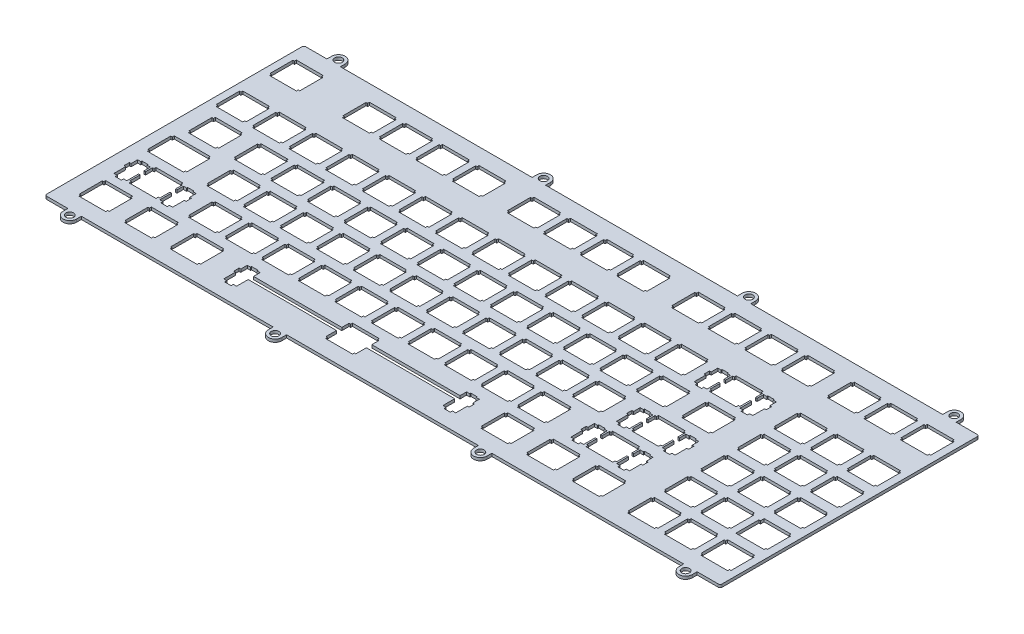
from build123d import *

# Parameters (mm, degrees)
SKETCH1_R           = 2
BOSS_EXTRUDE1_DEPTH = 1.5
FILLET1_R           = 1


with BuildPart() as part:
    # Sketch1 → Boss-Extrude1 (new body)
    with BuildSketch(Plane(origin=(0, 0, 0), x_dir=(1, 0, 0), z_dir=(0, 1, 0))):
        with BuildLine():
            Line((7.499068395, 437.918742248), (7.46317002, 435.419))
            Line((7.46317002, 435.419), (107.46317002, 435.419))
            Line((107.46317002, 435.419), (107.46317002, 437.919))
            ThreePointArc((107.46317002, 437.919), (110.96317002, 441.419), (114.46317002, 437.919))
            Line((114.46317002, 437.919), (114.46317002, 435.419))
            Line((114.46317002, 435.419), (214.46317002, 435.419))
            Line((214.46317002, 435.419), (214.46317002, 437.919))
            ThreePointArc((214.46317002, 437.919), (217.96317002, 441.419), (221.46317002, 437.919))
            Line((221.46317002, 437.919), (221.46317002, 435.419))
            Line((221.46317002, 435.419), (321.46317002, 435.419))
            Line((321.46317002, 435.419), (321.46317002, 437.919))
            ThreePointArc((321.46317002, 437.919), (324.96317002, 441.419), (328.46317002, 437.919))
            Line((328.46317002, 437.919), (328.46317002, 435.419))
            Line((328.46317002, 435.419), (340.46317002, 435.419))
            Line((340.46317002, 435.419), (340.46317002, 300.419))
            Line((340.46317002, 300.419), (328.46317002, 300.419))
            Line((328.46317002, 300.419), (328.46317002, 297.919))
            ThreePointArc((328.46317002, 297.919), (324.96317002, 294.419), (321.46317002, 297.919))
            Line((321.46317002, 297.919), (321.46317002, 300.419))
            Line((321.46317002, 300.419), (221.46317002, 300.419))
            Line((221.46317002, 300.419), (221.46317002, 297.919))
            ThreePointArc((221.46317002, 297.919), (217.96317002, 294.419), (214.46317002, 297.919))
            Line((214.46317002, 297.919), (214.46317002, 300.419))
            Line((214.46317002, 300.419), (114.46317002, 300.419))
            Line((114.46317002, 300.419), (114.46317002, 297.919))
            ThreePointArc((114.46317002, 297.919), (110.96317002, 294.419), (107.46317002, 297.919))
            Line((107.46317002, 297.919), (107.46317002, 300.419))
            Line((107.46317002, 300.419), (7.46317002, 300.419))
            Line((7.46317002, 300.419), (7.46317002, 297.919))
            ThreePointArc((7.46317002, 297.919), (3.96317002, 294.419), (0.46317002, 297.919))
            Line((0.46317002, 297.919), (0.46317002, 300.419))
            Line((0.46317002, 300.419), (-11.53682998, 300.419))
            Line((-11.53682998, 300.419), (-11.53682998, 435.419))
            Line((-11.53682998, 435.419), (0.46317002, 435.419))
            Line((0.46317002, 435.419), (0.499068405, 437.919))
            ThreePointArc((0.499068405, 437.919), (3.999197281, 441.418999998), (7.499068395, 437.918742248))
        make_face()
        with Locations((3.999068405, 437.919)):
            Circle(SKETCH1_R, mode=Mode.SUBTRACT)
        with Locations((110.96317002, 437.919)):
            Circle(SKETCH1_R, mode=Mode.SUBTRACT)
        with Locations((217.96317002, 437.919)):
            Circle(SKETCH1_R, mode=Mode.SUBTRACT)
        with Locations((3.96317002, 297.919)):
            Circle(SKETCH1_R, mode=Mode.SUBTRACT)
        with Locations((110.96317002, 297.919)):
            Circle(SKETCH1_R, mode=Mode.SUBTRACT)
        with Locations((324.96317002, 297.919)):
            Circle(SKETCH1_R, mode=Mode.SUBTRACT)
        with Locations((217.96317002, 297.919)):
            Circle(SKETCH1_R, mode=Mode.SUBTRACT)
        with Locations((324.96317002, 437.919)):
            Circle(SKETCH1_R, mode=Mode.SUBTRACT)
        Polygon((-7.7978, 425.99356), (-7.7978, 413.98444), (-6.985, 413.98444), (-6.985, 413.004), (6.985, 413.004), (6.985, 413.98444), (7.7978, 413.98444), (7.7978, 425.99356), (6.985, 425.99356), (6.985, 426.974), (-6.985, 426.974), (-6.985, 425.99356), align=None, mode=Mode.SUBTRACT)
        Polygon((30.3022, 413.98444), (30.3022, 425.99356), (31.115, 425.99356), (31.115, 426.974), (45.085, 426.974), (45.085, 425.99356), (45.8978, 425.99356), (45.8978, 413.98444), (45.085, 413.98444), (45.085, 413.004), (31.115, 413.004), (31.115, 413.98444), align=None, mode=Mode.SUBTRACT)
        Polygon((243.04752, 341.884), (257.01752, 341.884), (257.01752, 340.90356), (257.83032, 340.90356), (257.83032, 337.185), (258.64312, 337.185), (258.64312, 340.5886), (260.31952, 340.5886), (260.31952, 341.122), (263.62152, 341.122), (263.62152, 340.5886), (265.29792, 340.5886), (265.29792, 337.185), (266.18692, 337.185), (266.18692, 334.391), (265.29792, 334.391), (265.29792, 328.295), (263.62152, 328.295), (263.62152, 327.152), (260.31952, 327.152), (260.31952, 328.295), (258.64312, 328.295), (258.64312, 334.391), (257.83032, 334.391), (257.83032, 329.0824), (257.01752, 329.0824), (257.01752, 327.914), (243.04752, 327.914), (243.04752, 329.0824), (242.23472, 329.0824), (242.23472, 334.391), (241.42192, 334.391), (241.42192, 328.295), (239.74552, 328.295), (239.74552, 327.152), (236.44352, 327.152), (236.44352, 328.295), (234.76712, 328.295), (234.76712, 334.391), (233.87812, 334.391), (233.87812, 337.185), (234.76712, 337.185), (234.76712, 340.5886), (236.44352, 340.5886), (236.44352, 341.122), (239.74552, 341.122), (239.74552, 340.5886), (241.42192, 340.5886), (241.42192, 337.185), (242.23472, 337.185), (242.23472, 340.90356), (243.04752, 340.90356), align=None, mode=Mode.SUBTRACT)
        Polygon((250.19, 399.034), (264.16, 399.034), (264.16, 398.05356), (264.9728, 398.05356), (264.9728, 394.335), (265.7856, 394.335), (265.7856, 397.7386), (267.462, 397.7386), (267.462, 398.272), (270.764, 398.272), (270.764, 397.7386), (272.4404, 397.7386), (272.4404, 394.335), (273.3294, 394.335), (273.3294, 391.541), (272.4404, 391.541), (272.4404, 385.445), (270.764, 385.445), (270.764, 384.302), (267.462, 384.302), (267.462, 385.445), (265.7856, 385.445), (265.7856, 391.541), (264.9728, 391.541), (264.9728, 386.2324), (264.16, 386.2324), (264.16, 385.064), (250.19, 385.064), (250.19, 386.2324), (249.3772, 386.2324), (249.3772, 391.541), (248.5644, 391.541), (248.5644, 385.445), (246.888, 385.445), (246.888, 384.302), (243.586, 384.302), (243.586, 385.445), (241.9096, 385.445), (241.9096, 391.541), (241.0206, 391.541), (241.0206, 394.335), (241.9096, 394.335), (241.9096, 397.7386), (243.586, 397.7386), (243.586, 398.272), (246.888, 398.272), (246.888, 397.7386), (248.5644, 397.7386), (248.5644, 394.335), (249.3772, 394.335), (249.3772, 398.05356), (250.19, 398.05356), align=None, mode=Mode.SUBTRACT)
        Polygon((247.81002, 360.934), (261.78002, 360.934), (261.78002, 359.95356), (262.59282, 359.95356), (262.59282, 356.235), (263.40562, 356.235), (263.40562, 359.6386), (265.08202, 359.6386), (265.08202, 360.172), (268.38402, 360.172), (268.38402, 359.6386), (270.06042, 359.6386), (270.06042, 356.235), (270.94942, 356.235), (270.94942, 353.441), (270.06042, 353.441), (270.06042, 347.345), (268.38402, 347.345), (268.38402, 346.202), (265.08202, 346.202), (265.08202, 347.345), (263.40562, 347.345), (263.40562, 353.441), (262.59282, 353.441), (262.59282, 348.1324), (261.78002, 348.1324), (261.78002, 346.964), (247.81002, 346.964), (247.81002, 348.1324), (246.99722, 348.1324), (246.99722, 353.441), (246.18442, 353.441), (246.18442, 347.345), (244.50802, 347.345), (244.50802, 346.202), (241.20602, 346.202), (241.20602, 347.345), (239.52962, 347.345), (239.52962, 353.441), (238.64062, 353.441), (238.64062, 356.235), (239.52962, 356.235), (239.52962, 359.6386), (241.20602, 359.6386), (241.20602, 360.172), (244.50802, 360.172), (244.50802, 359.6386), (246.18442, 359.6386), (246.18442, 356.235), (246.99722, 356.235), (246.99722, 359.95356), (247.81002, 359.95356), align=None, mode=Mode.SUBTRACT)
        Polygon((4.92252, 341.884), (18.89252, 341.884), (18.89252, 340.90356), (19.70532, 340.90356), (19.70532, 337.185), (20.51812, 337.185), (20.51812, 340.5886), (22.19452, 340.5886), (22.19452, 341.122), (25.49652, 341.122), (25.49652, 340.5886), (27.17292, 340.5886), (27.17292, 337.185), (28.061919999, 337.185), (28.061919999, 334.391), (27.172919999, 334.391), (27.172919999, 328.295), (25.496519999, 328.295), (25.496519999, 327.152), (22.194519999, 327.152), (22.194519999, 328.295), (20.518119999, 328.295), (20.518119999, 334.391), (19.70532, 334.391), (19.70532, 329.0824), (18.89252, 329.0824), (18.89252, 327.914), (4.92252, 327.914), (4.92252, 329.0824), (4.10972, 329.0824), (4.10972, 334.391), (3.29692, 334.391), (3.29692, 328.295), (1.62052, 328.295), (1.62052, 327.152), (-1.68148, 327.152), (-1.68148, 328.295), (-3.35788, 328.295), (-3.35788, 334.391), (-4.24688, 334.391), (-4.24688, 337.185), (-3.35788, 337.185), (-3.35788, 340.5886), (-1.68148, 340.5886), (-1.68148, 341.122), (1.62052, 341.122), (1.62052, 340.5886), (3.29692, 340.5886), (3.29692, 337.185), (4.10972, 337.185), (4.10972, 340.90356), (4.92252, 340.90356), align=None, mode=Mode.SUBTRACT)
        Polygon((126.3652, 322.834), (140.3352, 322.834), (140.3352, 321.85356), (141.148, 321.85356), (141.148, 318.135), (187.1728, 318.135), (187.1728, 321.5386), (188.8492, 321.5386), (188.8492, 322.072), (192.1512, 322.072), (192.1512, 321.5386), (193.8276, 321.5386), (193.8276, 318.135), (194.7166, 318.135), (194.7166, 315.341), (193.8276, 315.341), (193.8276, 309.245), (192.1512, 309.245), (192.1512, 308.102), (188.8492, 308.102), (188.8492, 309.245), (187.1728, 309.245), (187.1728, 315.341), (141.148, 315.341), (141.148, 309.84444), (140.3352, 309.84444), (140.3352, 308.864), (126.3652, 308.864), (126.3652, 309.84444), (125.5524, 309.84444), (125.5524, 315.341), (79.5276, 315.341), (79.5276, 309.245), (77.8512, 309.245), (77.8512, 308.102), (74.5492, 308.102), (74.5492, 309.245), (72.8728, 309.245), (72.8728, 315.341), (71.9838, 315.341), (71.9838, 318.135), (72.8728, 318.135), (72.8728, 321.5386), (74.5492, 321.5386), (74.5492, 322.072), (77.8512, 322.072), (77.8512, 321.5386), (79.5276, 321.5386), (79.5276, 318.135), (125.5524, 318.135), (125.5524, 321.85356), (126.3652, 321.85356), align=None, mode=Mode.SUBTRACT)
        Polygon((-4.602, 360.934), (14.131, 360.934), (14.131, 359.95356), (14.9438, 359.95356), (14.9438, 347.94444), (14.131, 347.94444), (14.131, 346.964), (-4.602, 346.964), (-4.602, 347.94444), (-5.4148, 347.94444), (-5.4148, 359.95356), (-4.602, 359.95356), align=None, mode=Mode.SUBTRACT)
        Polygon((336.727800003, 359.95356), (336.727800003, 347.94444), (335.915000003, 347.94444), (335.915000003, 346.964), (321.945000003, 346.964), (321.945000003, 347.94444), (321.132200003, 347.94444), (321.132200003, 359.95356), (321.945000003, 359.95356), (321.945000003, 360.934), (335.915000003, 360.934), (335.915000003, 359.95356), align=None, mode=Mode.SUBTRACT)
        Polygon((317.677800003, 359.95356), (317.677800003, 347.94444), (316.865000003, 347.94444), (316.865000003, 346.964), (302.895000003, 346.964), (302.895000003, 347.94444), (302.082200003, 347.94444), (302.082200003, 359.95356), (302.895000003, 359.95356), (302.895000003, 360.934), (316.865000003, 360.934), (316.865000003, 359.95356), align=None, mode=Mode.SUBTRACT)
        Polygon((298.627800003, 359.95356), (298.627800003, 347.94444), (297.815000003, 347.94444), (297.815000003, 346.964), (283.845000003, 346.964), (283.845000003, 347.94444), (283.032200003, 347.94444), (283.032200003, 359.95356), (283.845000003, 359.95356), (283.845000003, 360.934), (297.815000003, 360.934), (297.815000003, 359.95356), align=None, mode=Mode.SUBTRACT)
        Polygon((49.3522, 425.99356), (49.3522, 413.98444), (50.165, 413.98444), (50.165, 413.004), (64.135, 413.004), (64.135, 413.98444), (64.9478, 413.98444), (64.9478, 425.99356), (64.135, 425.99356), (64.135, 426.974), (50.165, 426.974), (50.165, 425.99356), align=None, mode=Mode.SUBTRACT)
        Polygon((68.4022, 413.98444), (68.4022, 425.99356), (69.215, 425.99356), (69.215, 426.974), (83.185, 426.974), (83.185, 425.99356), (83.9978, 425.99356), (83.9978, 413.98444), (83.185, 413.98444), (83.185, 413.004), (69.215, 413.004), (69.215, 413.98444), align=None, mode=Mode.SUBTRACT)
        Polygon((87.4522, 413.98444), (87.4522, 425.99356), (88.265, 425.99356), (88.265, 426.974), (102.235, 426.974), (102.235, 425.99356), (103.0478, 425.99356), (103.0478, 413.98444), (102.235, 413.98444), (102.235, 413.004), (88.265, 413.004), (88.265, 413.98444), align=None, mode=Mode.SUBTRACT)
        Polygon((116.0272, 413.984025998), (116.0272, 425.993145998), (116.84, 425.993145998), (116.84, 426.973585998), (130.81, 426.973585998), (130.81, 425.993145998), (131.6228, 425.993145998), (131.6228, 413.984025998), (130.81, 413.984025998), (130.81, 413.003585998), (116.84, 413.003585998), (116.84, 413.984025998), align=None, mode=Mode.SUBTRACT)
        Polygon((135.0772, 413.98444), (135.0772, 425.99356), (135.89, 425.99356), (135.89, 426.974), (149.86, 426.974), (149.86, 425.99356), (150.6728, 425.99356), (150.6728, 413.98444), (149.86, 413.98444), (149.86, 413.004), (135.89, 413.004), (135.89, 413.98444), align=None, mode=Mode.SUBTRACT)
        Polygon((154.1272, 413.98444), (154.1272, 425.99356), (154.94, 425.99356), (154.94, 426.974), (168.91, 426.974), (168.91, 425.99356), (169.7228, 425.99356), (169.7228, 413.98444), (168.91, 413.98444), (168.91, 413.004), (154.94, 413.004), (154.94, 413.98444), align=None, mode=Mode.SUBTRACT)
        Polygon((254.9524, 322.834), (268.9224, 322.834), (268.9224, 321.85356), (269.7352, 321.85356), (269.7352, 309.84444), (268.9224, 309.84444), (268.9224, 308.864), (254.9524, 308.864), (254.9524, 309.84444), (254.1396, 309.84444), (254.1396, 321.85356), (254.9524, 321.85356), align=None, mode=Mode.SUBTRACT)
        Polygon((173.1728, 425.99356), (173.1728, 413.98444), (173.9856, 413.98444), (173.9856, 413.004), (187.9556, 413.004), (187.9556, 413.98444), (188.7684, 413.98444), (188.7684, 425.99356), (187.9556, 425.99356), (187.9556, 426.974), (173.9856, 426.974), (173.9856, 425.99356), align=None, mode=Mode.SUBTRACT)
        Polygon((201.7522, 425.99356), (201.7522, 413.98444), (202.565, 413.98444), (202.565, 413.004), (216.535, 413.004), (216.535, 413.98444), (217.3478, 413.98444), (217.3478, 425.99356), (216.535, 425.99356), (216.535, 426.974), (202.565, 426.974), (202.565, 425.99356), align=None, mode=Mode.SUBTRACT)
        Polygon((258.9022, 425.99356), (258.9022, 413.98444), (259.715, 413.98444), (259.715, 413.004), (273.685, 413.004), (273.685, 413.98444), (274.4978, 413.98444), (274.4978, 425.99356), (273.685, 425.99356), (273.685, 426.974), (259.715, 426.974), (259.715, 425.99356), align=None, mode=Mode.SUBTRACT)
        Polygon((255.4478, 413.98444), (255.4478, 425.99356), (254.635, 425.99356), (254.635, 426.974), (240.665, 426.974), (240.665, 425.99356), (239.8522, 425.99356), (239.8522, 413.98444), (240.665, 413.98444), (240.665, 413.004), (254.635, 413.004), (254.635, 413.98444), align=None, mode=Mode.SUBTRACT)
        Polygon((236.3978, 413.98444), (236.3978, 425.99356), (235.585, 425.99356), (235.585, 426.974), (221.615, 426.974), (221.615, 425.99356), (220.8022, 425.99356), (220.8022, 413.98444), (221.615, 413.98444), (221.615, 413.004), (235.585, 413.004), (235.585, 413.98444), align=None, mode=Mode.SUBTRACT)
        Polygon((231.1398, 322.834), (245.1098, 322.834), (245.1098, 321.85356), (245.9226, 321.85356), (245.9226, 309.84444), (245.1098, 309.84444), (245.1098, 308.864), (231.1398, 308.864), (231.1398, 309.84444), (230.327, 309.84444), (230.327, 321.85356), (231.1398, 321.85356), align=None, mode=Mode.SUBTRACT)
        Polygon((283.0322, 425.99356), (283.0322, 413.98444), (283.845, 413.98444), (283.845, 413.004), (297.815, 413.004), (297.815, 413.98444), (298.6278, 413.98444), (298.6278, 425.99356), (297.815, 425.99356), (297.815, 426.974), (283.845, 426.974), (283.845, 425.99356), align=None, mode=Mode.SUBTRACT)
        Polygon((302.0822, 425.99356), (302.0822, 413.98444), (302.895, 413.98444), (302.895, 413.004), (316.865, 413.004), (316.865, 413.98444), (317.6778, 413.98444), (317.6778, 425.99356), (316.865, 425.99356), (316.865, 426.974), (302.895, 426.974), (302.895, 425.99356), align=None, mode=Mode.SUBTRACT)
        Polygon((321.1322, 425.99356), (321.1322, 413.98444), (321.945, 413.98444), (321.945, 413.004), (335.915, 413.004), (335.915, 413.98444), (336.7278, 413.98444), (336.7278, 425.99356), (335.915, 425.99356), (335.915, 426.974), (321.945, 426.974), (321.945, 425.99356), align=None, mode=Mode.SUBTRACT)
        Polygon((-7.7978, 398.05356), (-7.7978, 386.04444), (-6.985, 386.04444), (-6.985, 385.064), (6.985, 385.064), (6.985, 386.04444), (7.7978, 386.04444), (7.7978, 398.05356), (6.985, 398.05356), (6.985, 399.034), (-6.985, 399.034), (-6.985, 398.05356), align=None, mode=Mode.SUBTRACT)
        Polygon((11.2522, 398.05356), (11.2522, 386.04444), (12.065, 386.04444), (12.065, 385.064), (26.035, 385.064), (26.035, 386.04444), (26.8478, 386.04444), (26.8478, 398.05356), (26.035, 398.05356), (26.035, 399.034), (12.065, 399.034), (12.065, 398.05356), align=None, mode=Mode.SUBTRACT)
        Polygon((207.3272, 322.834), (221.2972, 322.834), (221.2972, 321.85356), (222.11, 321.85356), (222.11, 309.84444), (221.2972, 309.84444), (221.2972, 308.864), (207.3272, 308.864), (207.3272, 309.84444), (206.5144, 309.84444), (206.5144, 321.85356), (207.3272, 321.85356), align=None, mode=Mode.SUBTRACT)
        Polygon((30.3022, 398.05356), (30.3022, 386.04444), (31.115, 386.04444), (31.115, 385.064), (45.085, 385.064), (45.085, 386.04444), (45.8978, 386.04444), (45.8978, 398.05356), (45.085, 398.05356), (45.085, 399.034), (31.115, 399.034), (31.115, 398.05356), align=None, mode=Mode.SUBTRACT)
        Polygon((49.3522, 398.05356), (49.3522, 386.04444), (50.165, 386.04444), (50.165, 385.064), (64.135, 385.064), (64.135, 386.04444), (64.9478, 386.04444), (64.9478, 398.05356), (64.135, 398.05356), (64.135, 399.034), (50.165, 399.034), (50.165, 398.05356), align=None, mode=Mode.SUBTRACT)
        Polygon((68.4022, 398.05356), (68.4022, 386.04444), (69.215, 386.04444), (69.215, 385.064), (83.185, 385.064), (83.185, 386.04444), (83.9978, 386.04444), (83.9978, 398.05356), (83.185, 398.05356), (83.185, 399.034), (69.215, 399.034), (69.215, 398.05356), align=None, mode=Mode.SUBTRACT)
        Polygon((87.4522, 398.05356), (87.4522, 386.04444), (88.265, 386.04444), (88.265, 385.064), (102.235, 385.064), (102.235, 386.04444), (103.0478, 386.04444), (103.0478, 398.05356), (102.235, 398.05356), (102.235, 399.034), (88.265, 399.034), (88.265, 398.05356), align=None, mode=Mode.SUBTRACT)
        Polygon((106.5022, 398.05356), (106.5022, 386.04444), (107.315, 386.04444), (107.315, 385.064), (121.285, 385.064), (121.285, 386.04444), (122.0978, 386.04444), (122.0978, 398.05356), (121.285, 398.05356), (121.285, 399.034), (107.315, 399.034), (107.315, 398.05356), align=None, mode=Mode.SUBTRACT)
        Polygon((45.4032, 322.834), (59.3732, 322.834), (59.3732, 321.85356), (60.186, 321.85356), (60.186, 309.84444), (59.3732, 309.84444), (59.3732, 308.864), (45.4032, 308.864), (45.4032, 309.84444), (44.5904, 309.84444), (44.5904, 321.85356), (45.4032, 321.85356), align=None, mode=Mode.SUBTRACT)
        Polygon((125.5522, 398.05356), (125.5522, 386.04444), (126.365, 386.04444), (126.365, 385.064), (140.335, 385.064), (140.335, 386.04444), (141.1478, 386.04444), (141.1478, 398.05356), (140.335, 398.05356), (140.335, 399.034), (126.365, 399.034), (126.365, 398.05356), align=None, mode=Mode.SUBTRACT)
        Polygon((144.6022, 398.05356), (144.6022, 386.04444), (145.415, 386.04444), (145.415, 385.064), (159.385, 385.064), (159.385, 386.04444), (160.1978, 386.04444), (160.1978, 398.05356), (159.385, 398.05356), (159.385, 399.034), (145.415, 399.034), (145.415, 398.05356), align=None, mode=Mode.SUBTRACT)
        Polygon((163.6522, 398.05356), (163.6522, 386.04444), (164.465, 386.04444), (164.465, 385.064), (178.435, 385.064), (178.435, 386.04444), (179.2478, 386.04444), (179.2478, 398.05356), (178.435, 398.05356), (178.435, 399.034), (164.465, 399.034), (164.465, 398.05356), align=None, mode=Mode.SUBTRACT)
        Polygon((182.7022, 398.05356), (182.7022, 386.04444), (183.515, 386.04444), (183.515, 385.064), (197.485, 385.064), (197.485, 386.04444), (198.2978, 386.04444), (198.2978, 398.05356), (197.485, 398.05356), (197.485, 399.034), (183.515, 399.034), (183.515, 398.05356), align=None, mode=Mode.SUBTRACT)
        Polygon((201.7522, 398.05356), (201.7522, 386.04444), (202.565, 386.04444), (202.565, 385.064), (216.535, 385.064), (216.535, 386.04444), (217.3478, 386.04444), (217.3478, 398.05356), (216.535, 398.05356), (216.535, 399.034), (202.565, 399.034), (202.565, 398.05356), align=None, mode=Mode.SUBTRACT)
        Polygon((21.5906, 322.834), (35.5606, 322.834), (35.5606, 321.85356), (36.3734, 321.85356), (36.3734, 309.84444), (35.5606, 309.84444), (35.5606, 308.864), (21.5906, 308.864), (21.5906, 309.84444), (20.7778, 309.84444), (20.7778, 321.85356), (21.5906, 321.85356), align=None, mode=Mode.SUBTRACT)
        Polygon((220.8022, 398.05356), (220.8022, 386.04444), (221.615, 386.04444), (221.615, 385.064), (235.585, 385.064), (235.585, 386.04444), (236.3978, 386.04444), (236.3978, 398.05356), (235.585, 398.05356), (235.585, 399.034), (221.615, 399.034), (221.615, 398.05356), align=None, mode=Mode.SUBTRACT)
        Polygon((283.0322, 398.05356), (283.0322, 386.04444), (283.845, 386.04444), (283.845, 385.064), (297.815, 385.064), (297.815, 386.04444), (298.6278, 386.04444), (298.6278, 398.05356), (297.815, 398.05356), (297.815, 399.034), (283.845, 399.034), (283.845, 398.05356), align=None, mode=Mode.SUBTRACT)
        Polygon((302.0822, 398.05356), (302.0822, 386.04444), (302.895, 386.04444), (302.895, 385.064), (316.865, 385.064), (316.865, 386.04444), (317.6778, 386.04444), (317.6778, 398.05356), (316.865, 398.05356), (316.865, 399.034), (302.895, 399.034), (302.895, 398.05356), align=None, mode=Mode.SUBTRACT)
        Polygon((321.1322, 398.05356), (321.1322, 386.04444), (321.945, 386.04444), (321.945, 385.064), (335.915, 385.064), (335.915, 386.04444), (336.7278, 386.04444), (336.7278, 398.05356), (335.915, 398.05356), (335.915, 399.034), (321.945, 399.034), (321.945, 398.05356), align=None, mode=Mode.SUBTRACT)
        Polygon((336.7278, 379.00356), (336.7278, 366.99444), (335.915, 366.99444), (335.915, 366.014), (321.945, 366.014), (321.945, 366.99444), (321.1322, 366.99444), (321.1322, 379.00356), (321.945, 379.00356), (321.945, 379.984), (335.915, 379.984), (335.915, 379.00356), align=None, mode=Mode.SUBTRACT)
        Polygon((-2.222, 322.834), (11.748, 322.834), (11.748, 321.85356), (12.5608, 321.85356), (12.5608, 309.84444), (11.748, 309.84444), (11.748, 308.864), (-2.222, 308.864), (-2.222, 309.84444), (-3.0348, 309.84444), (-3.0348, 321.85356), (-2.222, 321.85356), align=None, mode=Mode.SUBTRACT)
        Polygon((317.6778, 379.00356), (317.6778, 366.99444), (316.865, 366.99444), (316.865, 366.014), (302.895, 366.014), (302.895, 366.99444), (302.0822, 366.99444), (302.0822, 379.00356), (302.895, 379.00356), (302.895, 379.984), (316.865, 379.984), (316.865, 379.00356), align=None, mode=Mode.SUBTRACT)
        Polygon((298.6278, 379.00356), (298.6278, 366.99444), (297.815, 366.99444), (297.815, 366.014), (283.845, 366.014), (283.845, 366.99444), (283.0322, 366.99444), (283.0322, 379.00356), (283.845, 379.00356), (283.845, 379.984), (297.815, 379.984), (297.815, 379.00356), align=None, mode=Mode.SUBTRACT)
        Polygon((35.8775, 341.884), (49.8475, 341.884), (49.8475, 340.90356), (50.6603, 340.90356), (50.6603, 328.89444), (49.8475, 328.89444), (49.8475, 327.914), (35.8775, 327.914), (35.8775, 328.89444), (35.0647, 328.89444), (35.0647, 340.90356), (35.8775, 340.90356), align=None, mode=Mode.SUBTRACT)
        Polygon((302.079400001, 340.90356), (302.079400001, 328.89444), (302.892200001, 328.89444), (302.892200001, 327.914), (316.862200001, 327.914), (316.862200001, 328.89444), (317.675000001, 328.89444), (317.675000001, 340.90356), (316.862200001, 340.90356), (316.862200001, 341.884), (302.892200001, 341.884), (302.892200001, 340.90356), align=None, mode=Mode.SUBTRACT)
        Polygon((283.0322, 321.85356), (283.0322, 309.84444), (283.845, 309.84444), (283.845, 308.864), (297.815, 308.864), (297.815, 309.84444), (298.6278, 309.84444), (298.6278, 321.85356), (297.815, 321.85356), (297.815, 322.834), (283.845, 322.834), (283.845, 321.85356), align=None, mode=Mode.SUBTRACT)
        Polygon((302.0822, 321.85356), (302.0822, 309.84444), (302.895, 309.84444), (302.895, 308.864), (316.865, 308.864), (316.865, 309.84444), (317.6778, 309.84444), (317.6778, 321.85356), (316.865, 321.85356), (316.865, 322.834), (302.895, 322.834), (302.895, 321.85356), align=None, mode=Mode.SUBTRACT)
        Polygon((321.945, 322.834), (335.915, 322.834), (335.915, 321.85356), (336.7278, 321.85356), (336.7278, 309.84444), (335.915, 309.84444), (335.915, 308.864), (321.945, 308.864), (321.945, 309.84444), (321.1322, 309.84444), (321.1322, 321.85356), (321.945, 321.85356), align=None, mode=Mode.SUBTRACT)
        Polygon((-3.0353, 379.00356), (-3.0353, 366.99444), (-2.2225, 366.99444), (-2.2225, 366.014), (11.7475, 366.014), (11.7475, 366.99444), (12.5603, 366.99444), (12.5603, 379.00356), (11.7475, 379.00356), (11.7475, 379.984), (-2.2225, 379.984), (-2.2225, 379.00356), align=None, mode=Mode.SUBTRACT)
        Polygon((20.7772, 379.00356), (20.7772, 366.99444), (21.59, 366.99444), (21.59, 366.014), (35.56, 366.014), (35.56, 366.99444), (36.3728, 366.99444), (36.3728, 379.00356), (35.56, 379.00356), (35.56, 379.984), (21.59, 379.984), (21.59, 379.00356), align=None, mode=Mode.SUBTRACT)
        Polygon((39.8272, 379.00356), (39.8272, 366.99444), (40.64, 366.99444), (40.64, 366.014), (54.61, 366.014), (54.61, 366.99444), (55.4228, 366.99444), (55.4228, 379.00356), (54.61, 379.00356), (54.61, 379.984), (40.64, 379.984), (40.64, 379.00356), align=None, mode=Mode.SUBTRACT)
        Polygon((58.8772, 379.00356), (58.8772, 366.99444), (59.69, 366.99444), (59.69, 366.014), (73.66, 366.014), (73.66, 366.99444), (74.4728, 366.99444), (74.4728, 379.00356), (73.66, 379.00356), (73.66, 379.984), (59.69, 379.984), (59.69, 379.00356), align=None, mode=Mode.SUBTRACT)
        Polygon((77.9272, 379.00356), (77.9272, 366.99444), (78.74, 366.99444), (78.74, 366.014), (92.71, 366.014), (92.71, 366.99444), (93.5228, 366.99444), (93.5228, 379.00356), (92.71, 379.00356), (92.71, 379.984), (78.74, 379.984), (78.74, 379.00356), align=None, mode=Mode.SUBTRACT)
        Polygon((96.9772, 366.99444), (96.9772, 379.00356), (97.79, 379.00356), (97.79, 379.984), (111.76, 379.984), (111.76, 379.00356), (112.5728, 379.00356), (112.5728, 366.99444), (111.76, 366.99444), (111.76, 366.014), (97.79, 366.014), (97.79, 366.99444), align=None, mode=Mode.SUBTRACT)
        Polygon((116.0272, 366.99444), (116.0272, 379.00356), (116.84, 379.00356), (116.84, 379.984), (130.81, 379.984), (130.81, 379.00356), (131.6228, 379.00356), (131.6228, 366.99444), (130.81, 366.99444), (130.81, 366.014), (116.84, 366.014), (116.84, 366.99444), align=None, mode=Mode.SUBTRACT)
        Polygon((135.0772, 366.99444), (135.0772, 379.00356), (135.89, 379.00356), (135.89, 379.984), (149.86, 379.984), (149.86, 379.00356), (150.6728, 379.00356), (150.6728, 366.99444), (149.86, 366.99444), (149.86, 366.014), (135.89, 366.014), (135.89, 366.99444), align=None, mode=Mode.SUBTRACT)
        Polygon((154.1272, 366.99444), (154.1272, 379.00356), (154.94, 379.00356), (154.94, 379.984), (168.91, 379.984), (168.91, 379.00356), (169.7228, 379.00356), (169.7228, 366.99444), (168.91, 366.99444), (168.91, 366.014), (154.94, 366.014), (154.94, 366.99444), align=None, mode=Mode.SUBTRACT)
        Polygon((173.1772, 379.00356), (173.1772, 366.99444), (173.99, 366.99444), (173.99, 366.014), (187.96, 366.014), (187.96, 366.99444), (188.7728, 366.99444), (188.7728, 379.00356), (187.96, 379.00356), (187.96, 379.984), (173.99, 379.984), (173.99, 379.00356), align=None, mode=Mode.SUBTRACT)
        Polygon((192.2272, 366.99444), (192.2272, 379.00356), (193.04, 379.00356), (193.04, 379.984), (207.01, 379.984), (207.01, 379.00356), (207.8228, 379.00356), (207.8228, 366.99444), (207.01, 366.99444), (207.01, 366.014), (193.04, 366.014), (193.04, 366.99444), align=None, mode=Mode.SUBTRACT)
        Polygon((211.2772, 366.99444), (211.2772, 379.00356), (212.09, 379.00356), (212.09, 379.984), (226.06, 379.984), (226.06, 379.00356), (226.8728, 379.00356), (226.8728, 366.99444), (226.06, 366.99444), (226.06, 366.014), (212.09, 366.014), (212.09, 366.99444), align=None, mode=Mode.SUBTRACT)
        Polygon((230.3272, 366.99444), (230.3272, 379.00356), (231.14, 379.00356), (231.14, 379.984), (245.11, 379.984), (245.11, 379.00356), (245.9228, 379.00356), (245.9228, 366.99444), (245.11, 366.99444), (245.11, 366.014), (231.14, 366.014), (231.14, 366.99444), align=None, mode=Mode.SUBTRACT)
        Polygon((254.1397, 366.99444), (254.1397, 379.00356), (254.9525, 379.00356), (254.9525, 379.984), (268.9225, 379.984), (268.9225, 379.00356), (269.7353, 379.00356), (269.7353, 366.99444), (268.9225, 366.99444), (268.9225, 366.014), (254.9525, 366.014), (254.9525, 366.99444), align=None, mode=Mode.SUBTRACT)
        Polygon((25.5397, 359.95356), (25.5397, 347.94444), (26.3525, 347.94444), (26.3525, 346.964), (40.3225, 346.964), (40.3225, 347.94444), (41.1353, 347.94444), (41.1353, 359.95356), (40.3225, 359.95356), (40.3225, 360.934), (26.3525, 360.934), (26.3525, 359.95356), align=None, mode=Mode.SUBTRACT)
        Polygon((44.5897, 359.95356), (44.5897, 347.94444), (45.4025, 347.94444), (45.4025, 346.964), (59.3725, 346.964), (59.3725, 347.94444), (60.1853, 347.94444), (60.1853, 359.95356), (59.3725, 359.95356), (59.3725, 360.934), (45.4025, 360.934), (45.4025, 359.95356), align=None, mode=Mode.SUBTRACT)
        Polygon((63.6397, 359.95356), (63.6397, 347.94444), (64.4525, 347.94444), (64.4525, 346.964), (78.4225, 346.964), (78.4225, 347.94444), (79.2353, 347.94444), (79.2353, 359.95356), (78.4225, 359.95356), (78.4225, 360.934), (64.4525, 360.934), (64.4525, 359.95356), align=None, mode=Mode.SUBTRACT)
        Polygon((82.6897, 359.95356), (82.6897, 347.94444), (83.5025, 347.94444), (83.5025, 346.964), (97.4725, 346.964), (97.4725, 347.94444), (98.2853, 347.94444), (98.2853, 359.95356), (97.4725, 359.95356), (97.4725, 360.934), (83.5025, 360.934), (83.5025, 359.95356), align=None, mode=Mode.SUBTRACT)
        Polygon((101.7397, 359.95356), (101.7397, 347.94444), (102.5525, 347.94444), (102.5525, 346.964), (116.5225, 346.964), (116.5225, 347.94444), (117.3353, 347.94444), (117.3353, 359.95356), (116.5225, 359.95356), (116.5225, 360.934), (102.5525, 360.934), (102.5525, 359.95356), align=None, mode=Mode.SUBTRACT)
        Polygon((207.3275, 341.884), (221.2975, 341.884), (221.2975, 340.90356), (222.1103, 340.90356), (222.1103, 328.89444), (221.2975, 328.89444), (221.2975, 327.914), (207.3275, 327.914), (207.3275, 328.89444), (206.5147, 328.89444), (206.5147, 340.90356), (207.3275, 340.90356), align=None, mode=Mode.SUBTRACT)
        Polygon((120.7897, 359.95356), (120.7897, 347.94444), (121.6025, 347.94444), (121.6025, 346.964), (135.5725, 346.964), (135.5725, 347.94444), (136.3853, 347.94444), (136.3853, 359.95356), (135.5725, 359.95356), (135.5725, 360.934), (121.6025, 360.934), (121.6025, 359.95356), align=None, mode=Mode.SUBTRACT)
        Polygon((139.8397, 359.95356), (139.8397, 347.94444), (140.6525, 347.94444), (140.6525, 346.964), (154.6225, 346.964), (154.6225, 347.94444), (155.4353, 347.94444), (155.4353, 359.95356), (154.6225, 359.95356), (154.6225, 360.934), (140.6525, 360.934), (140.6525, 359.95356), align=None, mode=Mode.SUBTRACT)
        Polygon((158.8897, 359.95356), (158.8897, 347.94444), (159.7025, 347.94444), (159.7025, 346.964), (173.6725, 346.964), (173.6725, 347.94444), (174.4853, 347.94444), (174.4853, 359.95356), (173.6725, 359.95356), (173.6725, 360.934), (159.7025, 360.934), (159.7025, 359.95356), align=None, mode=Mode.SUBTRACT)
        Polygon((177.9397, 359.95356), (177.9397, 347.94444), (178.7525, 347.94444), (178.7525, 346.964), (192.7225, 346.964), (192.7225, 347.94444), (193.5353, 347.94444), (193.5353, 359.95356), (192.7225, 359.95356), (192.7225, 360.934), (178.7525, 360.934), (178.7525, 359.95356), align=None, mode=Mode.SUBTRACT)
        Polygon((196.9897, 347.94444), (196.9897, 359.95356), (197.8025, 359.95356), (197.8025, 360.934), (211.7725, 360.934), (211.7725, 359.95356), (212.5853, 359.95356), (212.5853, 347.94444), (211.7725, 347.94444), (211.7725, 346.964), (197.8025, 346.964), (197.8025, 347.94444), align=None, mode=Mode.SUBTRACT)
        Polygon((188.2775, 341.884), (202.2475, 341.884), (202.2475, 340.90356), (203.0603, 340.90356), (203.0603, 328.89444), (202.2475, 328.89444), (202.2475, 327.914), (188.2775, 327.914), (188.2775, 328.89444), (187.4647, 328.89444), (187.4647, 340.90356), (188.2775, 340.90356), align=None, mode=Mode.SUBTRACT)
        Polygon((216.0397, 347.94444), (216.0397, 359.95356), (216.8525, 359.95356), (216.8525, 360.934), (230.8225, 360.934), (230.8225, 359.95356), (231.6353, 359.95356), (231.6353, 347.94444), (230.8225, 347.94444), (230.8225, 346.964), (216.8525, 346.964), (216.8525, 347.94444), align=None, mode=Mode.SUBTRACT)
        Polygon((54.1147, 340.90356), (54.1147, 328.89444), (54.9275, 328.89444), (54.9275, 327.914), (68.8975, 327.914), (68.8975, 328.89444), (69.7103, 328.89444), (69.7103, 340.90356), (68.8975, 340.90356), (68.8975, 341.884), (54.9275, 341.884), (54.9275, 340.90356), align=None, mode=Mode.SUBTRACT)
        Polygon((73.1647, 340.90356), (73.1647, 328.89444), (73.9775, 328.89444), (73.9775, 327.914), (87.9475, 327.914), (87.9475, 328.89444), (88.7603, 328.89444), (88.7603, 340.90356), (87.9475, 340.90356), (87.9475, 341.884), (73.9775, 341.884), (73.9775, 340.90356), align=None, mode=Mode.SUBTRACT)
        Polygon((92.2147, 340.90356), (92.2147, 328.89444), (93.0275, 328.89444), (93.0275, 327.914), (106.9975, 327.914), (106.9975, 328.89444), (107.8103, 328.89444), (107.8103, 340.90356), (106.9975, 340.90356), (106.9975, 341.884), (93.0275, 341.884), (93.0275, 340.90356), align=None, mode=Mode.SUBTRACT)
        Polygon((169.2275, 341.884), (183.1975, 341.884), (183.1975, 340.90356), (184.0103, 340.90356), (184.0103, 328.89444), (183.1975, 328.89444), (183.1975, 327.914), (169.2275, 327.914), (169.2275, 328.89444), (168.4147, 328.89444), (168.4147, 340.90356), (169.2275, 340.90356), align=None, mode=Mode.SUBTRACT)
        Polygon((111.2647, 340.90356), (111.2647, 328.89444), (112.0775, 328.89444), (112.0775, 327.914), (126.0475, 327.914), (126.0475, 328.89444), (126.8603, 328.89444), (126.8603, 340.90356), (126.0475, 340.90356), (126.0475, 341.884), (112.0775, 341.884), (112.0775, 340.90356), align=None, mode=Mode.SUBTRACT)
        Polygon((130.3147, 340.90356), (130.3147, 328.89444), (131.1275, 328.89444), (131.1275, 327.914), (145.0975, 327.914), (145.0975, 328.89444), (145.9103, 328.89444), (145.9103, 340.90356), (145.0975, 340.90356), (145.0975, 341.884), (131.1275, 341.884), (131.1275, 340.90356), align=None, mode=Mode.SUBTRACT)
        Polygon((150.1775, 341.884), (164.1475, 341.884), (164.1475, 340.90356), (164.9603, 340.90356), (164.9603, 328.89444), (164.1475, 328.89444), (164.1475, 327.914), (150.1775, 327.914), (150.1775, 328.89444), (149.3647, 328.89444), (149.3647, 340.90356), (150.1775, 340.90356), align=None, mode=Mode.SUBTRACT)
        Polygon((298.625000001, 340.90356), (298.625000001, 328.89444), (297.812200001, 328.89444), (297.812200001, 327.914), (283.842200001, 327.914), (283.842200001, 328.89444), (283.029400001, 328.89444), (283.029400001, 340.90356), (283.842200001, 340.90356), (283.842200001, 341.884), (297.812200001, 341.884), (297.812200001, 340.90356), align=None, mode=Mode.SUBTRACT)
        Polygon((336.725000001, 340.90356), (336.725000001, 328.89444), (335.912200001, 328.89444), (335.912200001, 327.914), (321.942200001, 327.914), (321.942200001, 327.954047258), (321.129400001, 327.954047258), (321.129400001, 339.963167258), (321.942200001, 339.963167258), (321.942200001, 341.884), (335.912200001, 341.884), (335.912200001, 340.90356), align=None, mode=Mode.SUBTRACT)
    extrude(amount=BOSS_EXTRUDE1_DEPTH)

    # Fillet1
    fillet1_edges = [part.edges().sort_by_distance(p)[0] for p in [
        (340.46317002, 0.75, -435.419),
        (340.46317002, 0.75, -300.419),
        (-11.53682998, 0.75, -300.419),
        (-11.53682998, 0.75, -435.419),
    ]]
    fillet(fillet1_edges, radius=FILLET1_R)


solid = part.part
